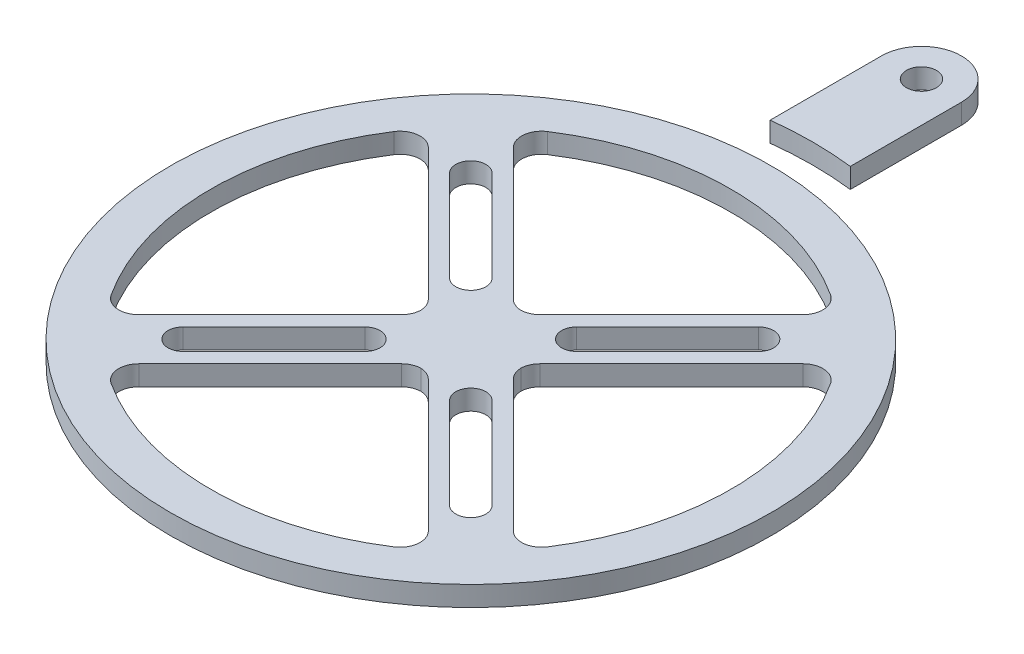
from build123d import *

# Parameters (mm, degrees)
SKETCH1_R                = 29.999999999999996
BOSS_EXTRUDE1_DEPTH      = 2
SKETCH2_R                = 1.5000000000000024
BOSS_EXTRUDE2_DEPTH      = 2
CUT_EXTRUDE1_DEPTH       = 2
FILLET1_R                = 2
CIRPATTERN3_COUNT        = 4
FILLET1_OF_CIRPATTERN3_R = 2


with BuildPart() as part:
    # Sketch1 → Boss-Extrude1 (new body)
    with BuildSketch(Plane(origin=(0, 0, 0), x_dir=(1, 0, 0), z_dir=(0, 1, 0))):
        with Locations(Location((0, 0, 0), (0, 0, 270))):
            Circle(SKETCH1_R)
    extrude(amount=BOSS_EXTRUDE1_DEPTH)

    # Sketch3 → Cut-Extrude1 (cut)
    with BuildSketch(Plane.XZ):
        with BuildLine():
            Line((-16.120955993884955, 20.363596681004037), (-0.707106781186571, 4.949747468305829))
            ThreePointArc((-0.707106781186571, 4.949747468305829), (-1.635e-14, 5), (0.7071067811865381, 4.9497474683058345))
            Line((0.7071067811865381, 4.9497474683058345), (16.1209559938848, 20.363596681004154))
            ThreePointArc((16.1209559938848, 20.363596681004154), (-1.0222e-13, 25.9723178007542), (-16.120955993884955, 20.363596681004037))
        make_face()
        with BuildLine():
            Line((4.226275356880876, 6.347595700440537), (13.308564754978745, 15.429885098538437))
            ThreePointArc((13.308564754978745, 15.429885098538437), (15.429885098538385, 15.42988509853844), (15.429885098538387, 13.3085647549788))
            Line((15.429885098538387, 13.3085647549788), (6.347595700440546, 4.226275356880927))
            ThreePointArc((6.347595700440546, 4.226275356880927), (4.226275356880893, 4.226275356880883), (4.226275356880876, 6.347595700440537))
        make_face()
    cut_extrude1 = extrude(amount=-CUT_EXTRUDE1_DEPTH, mode=Mode.SUBTRACT)

    # Fillet1
    # the kernel refuses this fillet: 2 mm, written as the material it adds along each edge
    with BuildSketch(Plane(origin=(16.1209559938848, 0, 20.363596681004154), x_dir=(-0.8124484694054139, 0, 0.5830330046925304), z_dir=(0, 1, 0))) as fillet1_piece_1:
        with BuildLine():
            CenterArc((2.355278550114305, -1.9977749052453315), FILLET1_R, 87.29705530283536, 102.03879267807281)
            Line((0.38176972340459264, -2.322217366860414), (0, 0))
            ThreePointArc((0, 0), (1.2247970633110545, 0.02889543405250306), (2.4495941266221117, -1e-17))
        make_face()
    extrude(amount=2)
    with BuildSketch(Plane(origin=(-16.120955993884955, 0, 20.36359668100404), x_dir=(0.8124484694054097, 0, 0.5830330046925363), z_dir=(0, 1, 0))) as fillet1_piece_2:
        with BuildLine():
            CenterArc((2.3552785501143045, 1.9977749052453322), FILLET1_R, 170.66415201909183, 102.03879267807281)
            Line((0.38176972340459064, 2.3222173668604142), (0, 0))
            ThreePointArc((0, 0), (1.224797063311054, -0.02889543405249918), (2.4495941266221117, 4e-17))
        make_face()
    extrude(amount=2)
    with BuildSketch(Plane(origin=(-0.707106781186571, 0, 4.94974746830583), x_dir=(0.9978329265871119, 0, 0.06579856091587097), z_dir=(0, 1, 0))) as fillet1_piece_3:
        with BuildLine():
            CenterArc((0.9117316045667684, -1.9942190443130732), FILLET1_R, 94.35739687847523, 44.41530859723521)
            Line((-0.592470470427697, -0.6761234037837734), (0, 0))
            ThreePointArc((0, 0), (0.3798881685694877, -0.01445238921731624), (0.7597763371389753, 0))
        make_face()
    extrude(amount=2)
    with BuildSketch(Plane(origin=(0.7071067811865382, 0, 4.949747468305835), x_dir=(0.7071067811865465, 0, 0.7071067811865486), z_dir=(0, 1, 0))) as fillet1_piece_4:
        with BuildLine():
            CenterArc((0.8989794855684893, -2), FILLET1_R, 89.99999999999997, 44.41530859720547)
            ThreePointArc((-0.5007289388793513, -0.5714285714288758), (-0.23949481251558302, -0.2952391013252418), (0, 0))
            Line((0, 0), (0.8989794855684903, 2e-17))
        make_face()
    extrude(amount=2)

    # CirPattern3: Cut-Extrude1 ×4 about axis
    cirpattern3_axis = Axis((-1.408e-14, 0, 2.84e-15), (0, 1, 0))
    for i in range(1, CIRPATTERN3_COUNT):
        add(cut_extrude1.rotate(cirpattern3_axis, i * 360 / CIRPATTERN3_COUNT), mode=Mode.SUBTRACT)

    # Fillet1 of CirPattern3
    # the kernel refuses this fillet: 2 mm, written as the material it adds along each edge
    with BuildSketch(Plane(origin=(20.36359668100414, 0, -16.120955993884806), x_dir=(0.5830330046925314, 0, 0.8124484694054133), z_dir=(0, 1, 0))) as fillet1_of_cirpattern3_piece_1:
        with BuildLine():
            CenterArc((2.3552785501143045, -1.9977749052453315), FILLET1_OF_CIRPATTERN3_R, 87.29705530283529, 102.03879267807281)
            Line((0.3817697234045918, -2.3222173668604116), (0, 0))
            ThreePointArc((0, 0), (1.2247970633110554, 0.02889543405249672), (2.449594126622114, 4e-17))
        make_face()
    extrude(amount=2)
    with BuildSketch(Plane(origin=(20.36359668100402, 0, 16.120955993884948), x_dir=(-0.7071067811865438, 0, -0.7071067811865513), z_dir=(0, 1, 0))) as fillet1_of_cirpattern3_piece_2:
        with BuildLine():
            CenterArc((2.353389389934555, -2), FILLET1_OF_CIRPATTERN3_R, 89.99999999999997, 102.03879267807287)
            ThreePointArc((0.3973761741995627, -2.4171478153725032), (0.17017539002267335, -1.2132613605629643), (0, 0))
            Line((0, 0), (2.3533893899345557, 5e-17))
        make_face()
    extrude(amount=2)
    with BuildSketch(Plane(origin=(4.949747468305813, 0, 0.7071067811865603), x_dir=(0.7071067811865409, 0, 0.707106781186554), z_dir=(0, 1, 0))) as fillet1_of_cirpattern3_piece_3:
        with BuildLine():
            CenterArc((0.8989794855684675, 1.9999999999999998), FILLET1_OF_CIRPATTERN3_R, 225.58469140279482, 44.41530859720535)
            ThreePointArc((-0.5007289388793674, 0.571428571428869), (-0.23949481251558677, 0.29523910132524234), (0, 0))
            Line((0, 0), (0.8989794855684747, 1e-17))
        make_face()
    extrude(amount=2)
    with BuildSketch(Plane(origin=(4.9497474683058185, 0, -0.7071067811865489), x_dir=(0.06579856091586167, 0, 0.9978329265871125), z_dir=(0, 1, 0))) as fillet1_of_cirpattern3_piece_4:
        with BuildLine():
            CenterArc((0.9117316045667834, 1.9942190443130732), FILLET1_OF_CIRPATTERN3_R, 221.2272945242899, 44.4153085972348)
            Line((-0.5924704704276744, 0.6761234037837643), (0, 0))
            ThreePointArc((0, 0), (0.3798881685694939, 0.0144523892173167), (0.7597763371389883, 0))
        make_face()
    extrude(amount=2)
    with BuildSketch(Plane(origin=(-16.120955993884824, 0, -20.36359668100415), x_dir=(0.8124484694054139, 0, -0.5830330046925304), z_dir=(0, 1, 0))) as fillet1_of_cirpattern3_piece_5:
        with BuildLine():
            CenterArc((2.3552785501143063, -1.9977749052453326), FILLET1_OF_CIRPATTERN3_R, 87.2970553028354, 102.03879267807275)
            Line((0.38176972340459264, -2.322217366860414), (0, 0))
            ThreePointArc((0, 0), (1.2247970633110539, 0.02889543405249918), (2.4495941266221117, -1e-17))
        make_face()
    extrude(amount=2)
    with BuildSketch(Plane(origin=(16.12095599388493, 0, -20.36359668100403), x_dir=(-0.7071067811865509, 0, 0.7071067811865441), z_dir=(0, 1, 0))) as fillet1_of_cirpattern3_piece_6:
        with BuildLine():
            CenterArc((2.3533893899345526, -2), FILLET1_OF_CIRPATTERN3_R, 89.99999999999996, 102.03879267807292)
            ThreePointArc((0.39737617419956145, -2.4171478153725032), (0.17017539002267143, -1.2132613605629632), (0, 0))
            Line((0, 0), (2.353389389934554, -1.2e-16))
        make_face()
    extrude(amount=2)
    with BuildSketch(Plane(origin=(0.7071067811865434, 0, -4.949747468305825), x_dir=(0.7071067811865541, 0, -0.7071067811865409), z_dir=(0, 1, 0))) as fillet1_of_cirpattern3_piece_7:
        with BuildLine():
            CenterArc((0.8989794855684662, 1.9999999999999998), FILLET1_OF_CIRPATTERN3_R, 225.58469140279482, 44.41530859720535)
            ThreePointArc((-0.5007289388793689, 0.5714285714288692), (-0.23949481251558713, 0.2952391013252426), (0, 0))
            Line((0, 0), (0.8989794855684736, -1e-17))
        make_face()
    extrude(amount=2)
    with BuildSketch(Plane(origin=(-0.7071067811865659, 0, -4.94974746830583), x_dir=(0.9978329265871123, 0, -0.06579856091586292), z_dir=(0, 1, 0))) as fillet1_of_cirpattern3_piece_8:
        with BuildLine():
            CenterArc((0.911731604566765, 1.9942190443130734), FILLET1_OF_CIRPATTERN3_R, 221.22729452428956, 44.41530859723525)
            Line((-0.5924704704277004, 0.6761234037837739), (0, 0))
            ThreePointArc((0, 0), (0.37988816856948704, 0.01445238921731667), (0.7597763371389734, 1e-17))
        make_face()
    extrude(amount=2)
    with BuildSketch(Plane(origin=(-20.363596681004168, 0, 16.120955993884813), x_dir=(0.7071067811865483, 0, -0.7071067811865468), z_dir=(0, 1, 0))) as fillet1_of_cirpattern3_piece_9:
        with BuildLine():
            CenterArc((2.353389389934557, 2), FILLET1_OF_CIRPATTERN3_R, 167.96120732192713, 102.03879267807281)
            ThreePointArc((0.3973761741995647, 2.4171478153725037), (0.17017539002267684, 1.2132613605629667), (0, 0))
            Line((0, 0), (2.3533893899345557, -1e-17))
        make_face()
    extrude(amount=2)
    with BuildSketch(Plane(origin=(-20.363596681004047, 0, -16.12095599388494), x_dir=(0.7071067811865438, 0, 0.7071067811865513), z_dir=(0, 1, 0))) as fillet1_of_cirpattern3_piece_10:
        with BuildLine():
            CenterArc((2.353389389934555, -2), FILLET1_OF_CIRPATTERN3_R, 89.99999999999997, 102.03879267807287)
            ThreePointArc((0.3973761741995627, -2.4171478153725032), (0.17017539002267457, -1.2132613605629707), (0, 0))
            Line((0, 0), (2.3533893899345557, 5e-17))
        make_face()
    extrude(amount=2)
    with BuildSketch(Plane(origin=(-4.949747468305842, 0, -0.7071067811865552), x_dir=(-0.7071067811865421, 0, -0.707106781186553), z_dir=(0, 1, 0))) as fillet1_of_cirpattern3_piece_11:
        with BuildLine():
            CenterArc((0.898979485568472, 2), FILLET1_OF_CIRPATTERN3_R, 225.58469140279476, 44.41530859720535)
            ThreePointArc((-0.5007289388793642, 0.5714285714288699), (-0.23949481251558577, 0.29523910132524217), (0, 0))
            Line((0, 0), (0.898979485568476, 0))
        make_face()
    extrude(amount=2)
    with BuildSketch(Plane(origin=(-4.949747468305847, 0, 0.707106781186554), x_dir=(-0.06579856091586256, 0, -0.9978329265871123), z_dir=(0, 1, 0))) as fillet1_of_cirpattern3_piece_12:
        with BuildLine():
            CenterArc((0.9117316045667706, 1.994219044313073), FILLET1_OF_CIRPATTERN3_R, 221.22729452428956, 44.41530859723525)
            Line((-0.5924704704276954, 0.6761234037837742), (0, 0))
            ThreePointArc((0, 0), (0.3798881685694889, 0.01445238921731668), (0.7597763371389777, 0))
        make_face()
    extrude(amount=2)


with BuildPart() as body_2:
    # Sketch2 → Boss-Extrude2 (new body)
    with BuildSketch(Plane(origin=(0, 0, 0), x_dir=(1, 0, 0), z_dir=(0, 1, 0))):
        with BuildLine():
            Line((-4, 33.89323148929319), (-3.999999999999999, 45))
            ThreePointArc((-3.999999999999999, 45), (2.4e-16, 49), (4, 45))
            Line((4, 45), (4, 33.89323148929319))
            ThreePointArc((4, 33.89323148929319), (2.09e-15, 34.128450606302295), (-4, 33.89323148929319))
        make_face()
        with Locations(Location((0, 45, 0), (0, 0, 270))):
            Circle(SKETCH2_R, mode=Mode.SUBTRACT)
    extrude(amount=BOSS_EXTRUDE2_DEPTH)


solid = Compound([part.part, body_2.part])
